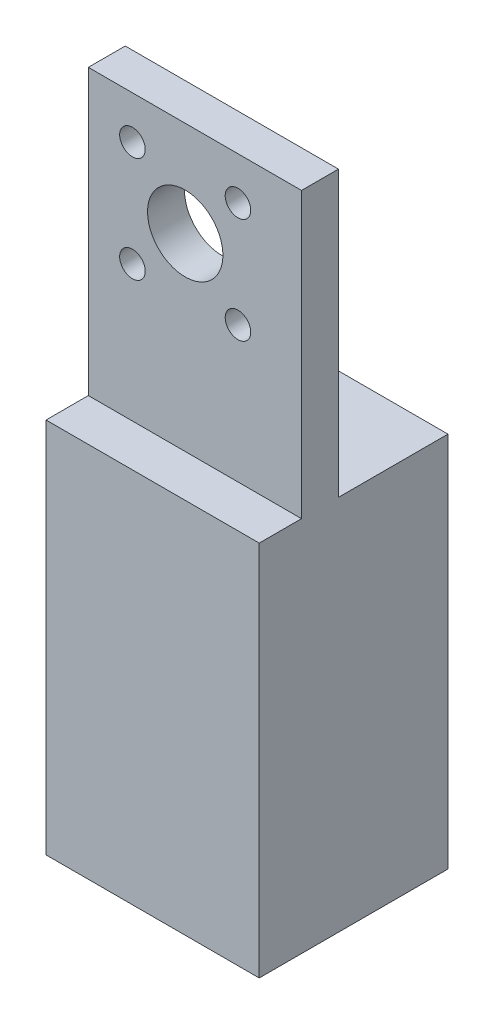
from build123d import *

# Parameters (mm, degrees)
CROQUIS1_W              = 30
CROQUIS1_H              = 26.5572604
CROQUIS1_W_2            = 24
CROQUIS1_H_2            = 21.24580832
SALIENTE_EXTRUIR1_DEPTH = 50
CROQUIS2_W              = 30
CROQUIS2_H              = 26.5572604
SALIENTE_EXTRUIR2_DEPTH = 3
CROQUIS3_W              = 30
CROQUIS3_H              = 5.19663203
SALIENTE_EXTRUIR3_DEPTH = 40
CROQUIS4_R              = 1.8
CROQUIS4_R_2            = 5.3
CORTAR_EXTRUIR1_DEPTH   = 40


with BuildPart() as part:
    # Croquis1 → Saliente-Extruir1 (new body)
    with BuildSketch(Plane(origin=(0, 0, 0), x_dir=(1, 0, 0), z_dir=(0, 1, 0))):
        Rectangle(CROQUIS1_W, CROQUIS1_H)
        Rectangle(CROQUIS1_W_2, CROQUIS1_H_2, mode=Mode.SUBTRACT)
    extrude(amount=SALIENTE_EXTRUIR1_DEPTH)

    # Croquis2 → Saliente-Extruir2 (add)
    with BuildSketch(Plane(origin=(0, 50, 0), x_dir=(1, 0, 0), z_dir=(0, 1, 0))):
        Rectangle(CROQUIS2_W, CROQUIS2_H)
    extrude(amount=SALIENTE_EXTRUIR2_DEPTH)

    # Croquis3 → Saliente-Extruir3 (add)
    with BuildSketch(Plane(origin=(0, 53, 0), x_dir=(1, 0, 0), z_dir=(0, 1, 0))):
        with Locations((0, -4.72984865)):
            Rectangle(CROQUIS3_W, CROQUIS3_H)
    extrude(amount=SALIENTE_EXTRUIR3_DEPTH)

    # Croquis4 → Cortar-Extruir1 (cut)
    with BuildSketch(Plane(origin=(0, 0, 2.131532635), x_dir=(-1, 0, 0), z_dir=(0, 0, -1))):
        with Locations((8.790188019, 86.992803585)):
            Circle(CROQUIS4_R)
        with Locations((8.790188019, 72.14356118)):
            Circle(CROQUIS4_R)
        with Locations((-6.059054386, 72.14356118)):
            Circle(CROQUIS4_R)
        with Locations((-6.059054386, 86.992803585)):
            Circle(CROQUIS4_R)
        with Locations((1.365566816, 79.568182382)):
            Circle(CROQUIS4_R_2)
    extrude(amount=-CORTAR_EXTRUIR1_DEPTH, mode=Mode.SUBTRACT)


solid = part.part
